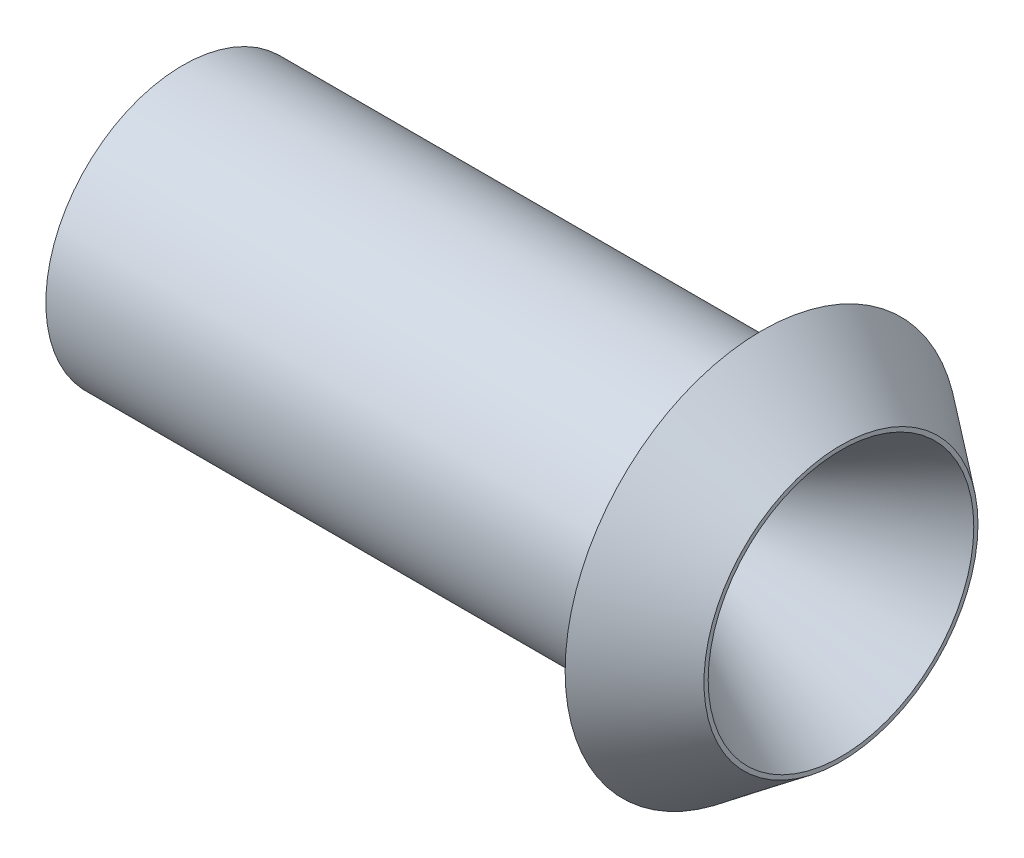
from build123d import *


with BuildPart() as part:
    # Sketch1 → Revolve1 (revolve)
    with BuildSketch(Plane.XY):
        Polygon((0, 8.255), (0, 8.001), (29.400718932, 2.81686), (30.670718932, 2.81686), (39.649912806, 8.001), (39.649912806, 8.255), (34.880381013, 11.8491), (34.880381013, 8.255), align=None)
    revolve(axis=Axis((39.649912806, 0, 0), (-1, 0, 0)))


solid = part.part
